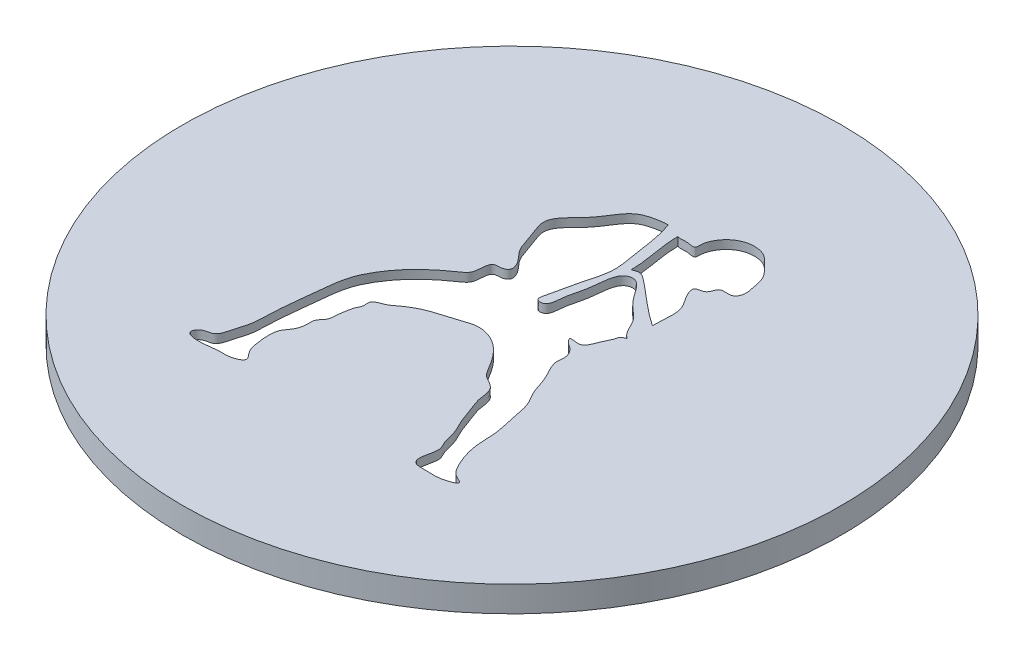
from build123d import *

# Parameters (mm, degrees)
SKETCH_1_R      = 38.5
EXTRUDE_1_DEPTH = 1
EXTRUDE_START   = 2
SKETCH_2_R      = 38.5
SKETCH_2_R_2    = 37.5
EXTRUDE_2_DEPTH = 2
EXTRUDE_START_2 = -1
SKETCH_3_R      = 38.5
SKETCH_3_R_2    = 37.5
EXTRUDE_3_DEPTH = 1


with BuildPart() as part:
    # 草图1 → 凸台-拉伸1 (new body)
    with BuildSketch(Plane(origin=(0, 0, 0), x_dir=(1, 0, 0), z_dir=(0, 1, 0))):
        with Locations((35, 20)):
            Circle(SKETCH_1_R)
        with BuildLine():
            add(Edge.make_bspline(
                [(35, 38.258739901), (34.633410358, 38.275292303), (33.648756906, 38.129557348), (31.304085768, 37.538845922), (30.116809269, 34.335682367), (26.764147881, 32.007036994), (28.155102887, 29.129098944), (28.671108002, 26.926027586), (30.029391368, 25.849398624), (30.431543391, 24.614867182), (29.697478915, 24.040650695), (28.587858953, 24.306331755), (28.412525051, 22.971900317), (28.399839911, 21.881807573), (26.522843438, 20.602994913), (24.596117336, 19.062333519), (22.80971293, 16.695757264), (21.504850049, 14.256170002), (21.20836736, 10.606153253), (20.739121073, 7.259344361), (20.734767998, 4.868108115), (20.58068809, 3.550553604), (20.13348083, 2.371159397), (19.767729569, 0.471524993), (18.318157064, 0.587963472), (17.519659112, -0.747085874), (19.679987678, -1.069835858), (21.22834172, -0.617763883), (22.824185925, -0.854573911), (24.273065374, -0.043508374), (23.18821231, 0.968276035), (22.939501713, 2.197054565), (22.770300237, 3.598999888), (22.862473369, 4.926323948), (23.767953582, 5.874370365), (24.007093648, 6.976739166), (23.880395353, 8.080119032), (24.804966211, 8.772623404), (24.708129164, 9.96487246), (24.928348615, 10.822174004), (25.049237011, 11.609746618), (25.500015752, 12.177881506), (25.158296347, 13.273933952), (26.546375668, 13.576947191), (27.69753132, 14.55620871), (29.610686463, 15.666511193), (31.876949735, 16.161236049), (33.779751425, 16.957433012), (35.558571348, 16.753562852), (37.24309792, 15.767593916), (38.384921463, 14.312500731), (39.092400798, 13.091101331), (39.681831696, 12.218974357), (40.535862034, 11.884174201), (41.488111322, 11.08685107), (41.452164184, 9.617433249), (42.148609817, 8.115237976), (42.639322196, 6.37446576), (43.614460484, 4.824981335), (43.786251723, 3.342650731), (44.528833885, 2.126921966), (44.048650315, 0.954303739), (43.993752505, -0.795860267), (45.875356025, -0.697141881), (47.022060959, -0.898025913), (49.523388321, -0.091958702), (47.808762454, 0.469455675), (47.141171046, 1.461525577), (46.473620609, 2.950413704), (45.984495974, 4.886223009), (46.100032136, 7.099932194), (45.381258722, 9.515486899), (45.160704471, 11.77843003), (43.877669435, 13.582373735), (43.499699692, 15.513206741), (42.530276392, 16.84774707), (42.252620293, 18.036652434), (42.496029137, 18.940308464), (41.885145521, 20.110401356), (41.03520154, 20.422572271), (40.580504244, 21.242466332), (42.178146682, 20.663973946), (42.657231039, 21.900896385), (43.011277612, 22.805568845), (43.404249303, 23.471568354), (43.473930796, 24.173521441), (43.937265165, 24.27946204), (44.094595969, 24.374768675)],
                knots=[0.011136532, 0.011136532, 0.011136532, 0.011136532, 0.017894522, 0.028840095, 0.053565641, 0.076394298, 0.090782479, 0.105824611, 0.117198548, 0.122579314, 0.125774425, 0.132433961, 0.138902275, 0.145561811, 0.152221347, 0.177469322, 0.192360498, 0.206081863, 0.227670919, 0.258486171, 0.268312899, 0.271611105, 0.282626246, 0.293056088, 0.300380672, 0.305512958, 0.314184243, 0.327371696, 0.338888629, 0.344534344, 0.349971311, 0.359788281, 0.368495546, 0.375849975, 0.383140359, 0.391480836, 0.39596274, 0.402399004, 0.409753433, 0.41628014, 0.41885768, 0.42425714, 0.428730315, 0.436258061, 0.443934885, 0.458083069, 0.475465075, 0.486740305, 0.49516934, 0.507307465, 0.521590358, 0.528495312, 0.533472976, 0.540377931, 0.544929057, 0.555303454, 0.564763618, 0.575464381, 0.58835208, 0.597645532, 0.602528072, 0.613210558, 0.620250038, 0.62880334, 0.639430809, 0.649602531, 0.655453891, 0.662581643, 0.672715939, 0.684786262, 0.699069154, 0.712776809, 0.730949082, 0.739584237, 0.75267353, 0.76630399, 0.769155091, 0.774753544, 0.782934379, 0.790233963, 0.791484254, 0.79764122, 0.80574885, 0.812136354, 0.816139236, 0.820033244, 0.823536287, 0.823536287, 0.823536287, 0.823536287], degree=3))
            add(Edge.make_bspline(
                [(35, 38.258739901), (35.646586984, 36.494785413), (35.854259651, 33.920456931), (36.618535367, 30.110976977), (35.503955442, 27.120323982), (35.249900164, 24.991471057), (34.621854012, 22.916936973), (36.140808103, 22.969717509), (36.103696368, 25.078160659), (36.812917453, 26.910164273), (36.846057786, 28.996415147), (37.286582676, 30.502554071), (39.089150894, 31.174250644), (40.354614753, 28.190073978), (42.8794243, 26.828060943), (43.340226432, 24.821914631), (44.094595969, 24.374768675)],
                knots=[0, 0, 0, 0, 0.166956262, 0.232571473, 0.34707052, 0.42909929, 0.46518225, 0.483663884, 0.532842766, 0.611756674, 0.673238179, 0.722616848, 0.734591526, 0.836705779, 0.924346435, 1, 1, 1, 1], degree=3))
        make_face(mode=Mode.SUBTRACT)
        with BuildLine():
            add(Edge.make_bspline(
                [(36.71993817, 37.653072256), (36.724570913, 35.436192985), (37.34339497, 33.997633901), (37.355079164, 31.504527216), (37.855863928, 31.785870201), (38.439729709, 31.764865802), (40.731795505, 29.994488362), (42.335980004, 28.428188298), (44.268407222, 27.137601451)],
                knots=[0, 0, 0, 0, 0.408865468, 0.417464776, 0.441782685, 0.484003627, 0.550110082, 1, 1, 1, 1], degree=3))
            add(Edge.make_bspline(
                [(44.268407222, 27.137601451), (44.25337697, 27.653351974), (44.341563782, 28.738016296), (44.437081139, 30.992932856), (42.97685844, 32.16636439), (42.912340862, 33.53840476), (44.257016884, 33.368546972), (44.278868776, 35.161826415), (45.942800667, 34.499626149), (46.536686031, 35.680996628), (46.273294129, 36.963041438), (46.000931438, 38.635417048), (44.692049792, 39.735605729), (43.791596461, 40.794489688), (42.469955821, 41.224519673), (41.065219278, 41.052355135), (39.852561695, 40.261595971), (39.104509797, 39.185963962), (38.870382739, 38.310862093), (38.901564764, 37.347948353), (37.84502449, 37.719378008), (37.194480435, 37.525430197), (36.80146745, 37.625768649), (36.71993817, 37.653072256)],
                knots=[0.840261755, 0.840261755, 0.840261755, 0.840261755, 0.84961404, 0.861989672, 0.878687233, 0.879473273, 0.885978908, 0.893394391, 0.902120847, 0.907245198, 0.913938084, 0.926247826, 0.936822908, 0.94433154, 0.951416806, 0.961312792, 0.969270836, 0.977449049, 0.984312845, 0.986958297, 0.992067555, 0.998355872, 1, 1, 1, 1], degree=3))
        make_face(mode=Mode.SUBTRACT)
    extrude(amount=EXTRUDE_1_DEPTH)

    # 草图2 → 凸台-拉伸2 (add)
    with BuildSketch(Plane(origin=(0, 0, 0), x_dir=(-1, 0, 0), z_dir=(0, -1, 0)).offset(EXTRUDE_START)):
        with Locations((-35, 20)):
            Circle(SKETCH_2_R)
        with Locations((-35, 20)):
            Circle(SKETCH_2_R_2, mode=Mode.SUBTRACT)
    extrude(amount=-EXTRUDE_2_DEPTH)

    # 草图3 → 凸台-拉伸3 (add)
    with BuildSketch(Plane(origin=(0, 1, 0), x_dir=(1, 0, 0), z_dir=(0, 1, 0)).offset(EXTRUDE_START_2)):
        with Locations((35, 20)):
            Circle(SKETCH_3_R)
        with Locations((35, 20)):
            Circle(SKETCH_3_R_2, mode=Mode.SUBTRACT)
    extrude(amount=EXTRUDE_3_DEPTH)


solid = part.part
